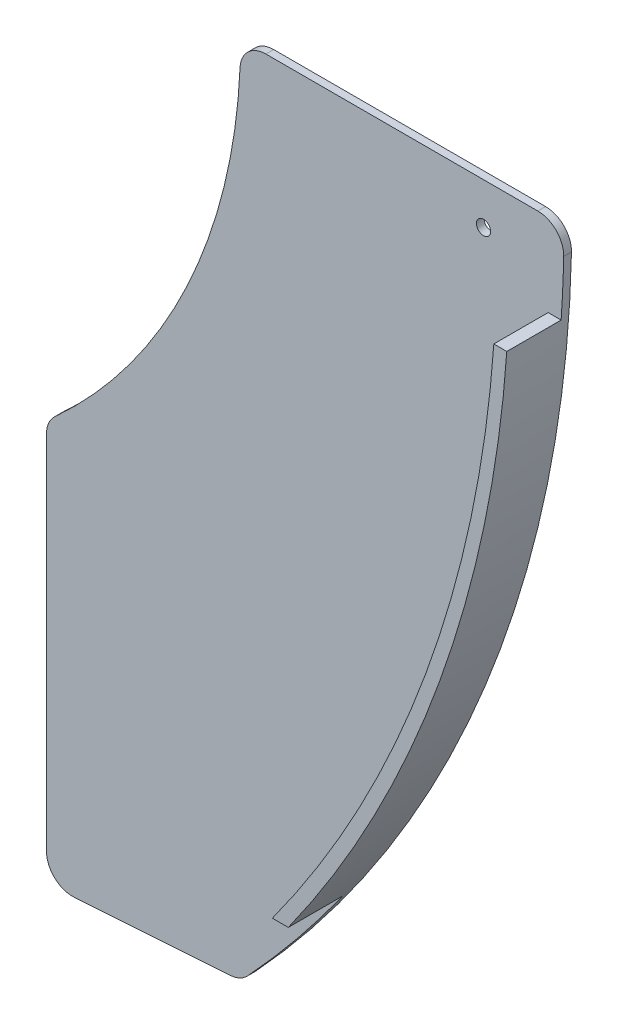
from build123d import *
from build123d.topology import SkipClean

# Parameters (mm, degrees)
RESSALTO_EXTRUS_O1_DEPTH    = 1.25
ESBO_O2_R                   = 2.75
CORTE_EXTRUS_O1_DEPTH       = 343.874678981
CONVERTER_S_LIDO1_START     = -1.75
CONVERTER_S_LIDO1_OUTLINE_R = 2.75
CONVERTER_S_LIDO1_DEPTH     = 0.5
RESSALTO_EXTRUS_O2_DEPTH    = 24


# Read off the part's stored shape, not the designer's step: Converter-Sólido1
with BuildPart() as part:
    # Esboço1 → Ressalto-extrusão1 (new, symmetric)
    with BuildSketch(Plane.XY):
        with BuildLine():
            Line((9.781555201, 0), (114.888726767, 0))
            ThreePointArc((114.888726767, 0), (122.038034046, -3.008047095), (124.886250727, -10.222518914))
            ThreePointArc((124.886250727, -10.222518914), (91.45004484, -172.337167523), (2.728289048, -312.078318252))
            ThreePointArc((2.728289048, -312.078318252), (-0.303175893, -314.310106116), (-3.944968584, -315.262997906))
            Line((-3.944968584, -315.262997906), (-64.334809895, -319.288987326))
            ThreePointArc((-64.334809895, -319.288987326), (-71.831840855, -316.613597697), (-75, -309.311135748))
            Line((-75, -309.311135748), (-75, -169.484512567))
            ThreePointArc((-75, -169.484512567), (-74.144640734, -165.437841608), (-71.72489083, -162.083442149))
            ThreePointArc((-71.72489083, -162.083442149), (-20.715574655, -92.974656039), (-0.208905725, -9.563318777))
            ThreePointArc((-0.208905725, -9.563318777), (2.866600834, -2.776191717), (9.781555201, 0))
        make_face()
    extrude(amount=RESSALTO_EXTRUS_O1_DEPTH, both=True)

    # Esboço2 → Corte-extrusão1 (cut, through all)
    with BuildSketch(Plane.XY.offset(1.25)):
        with Locations((93.886250727, -16)):
            Circle(ESBO_O2_R)
    extrude(amount=-CORTE_EXTRUS_O1_DEPTH, mode=Mode.SUBTRACT)

    # Converter-Sólido1 outline → Converter-Sólido1 (add)
    with BuildSketch(Plane.XY.offset(CONVERTER_S_LIDO1_START)):
        with BuildLine():
            ThreePointArc((2.728289048, -312.078318252), (91.45004484, -172.337167523), (124.886250727, -10.222518914))
            ThreePointArc((124.886250727, -10.222518914), (122.038034046, -3.008047095), (114.888726767, 0))
            Line((114.888726767, 0), (9.781555201, 0))
            ThreePointArc((9.781555201, 0), (2.866600835, -2.776191716), (-0.208905725, -9.563318777))
            ThreePointArc((-0.208905725, -9.563318777), (-20.715574655, -92.974656038), (-71.72489083, -162.083442149))
            ThreePointArc((-71.72489083, -162.083442149), (-74.144640734, -165.437841608), (-75, -169.484512567))
            Line((-75, -169.484512567), (-75, -309.311135748))
            ThreePointArc((-75, -309.311135748), (-71.831840855, -316.613597697), (-64.334809895, -319.288987326))
            Line((-64.334809895, -319.288987326), (-3.944968584, -315.262997906))
            ThreePointArc((-3.944968584, -315.262997906), (-0.303175894, -314.310106116), (2.728289048, -312.078318252))
        make_face()
        with Locations((93.886250727, -16)):
            Circle(CONVERTER_S_LIDO1_OUTLINE_R, mode=Mode.SUBTRACT)
    extrude(amount=CONVERTER_S_LIDO1_DEPTH)

    # Esboço8 → Ressalto-extrusão2 (add)
    with SkipClean():  # the faces are left unmerged after this step: merging them gives an invalid solid
        with BuildSketch(Plane(origin=(0, 0, -1.75), x_dir=(-1, 0, 0), z_dir=(0, 0, -1))):
            with BuildLine():
                Line((-118.871838966, -32), (-123.884147664, -32))
                ThreePointArc((-123.884147664, -32), (-97.937341323, -155.347298973), (-39.44403165, -267))
                Line((-39.44403165, -267), (-33.282417311, -267))
                ThreePointArc((-33.282417311, -267), (-92.563373986, -155.504460627), (-118.871838966, -32))
            make_face()
        extrude(amount=-RESSALTO_EXTRUS_O2_DEPTH)


solid = part.part
